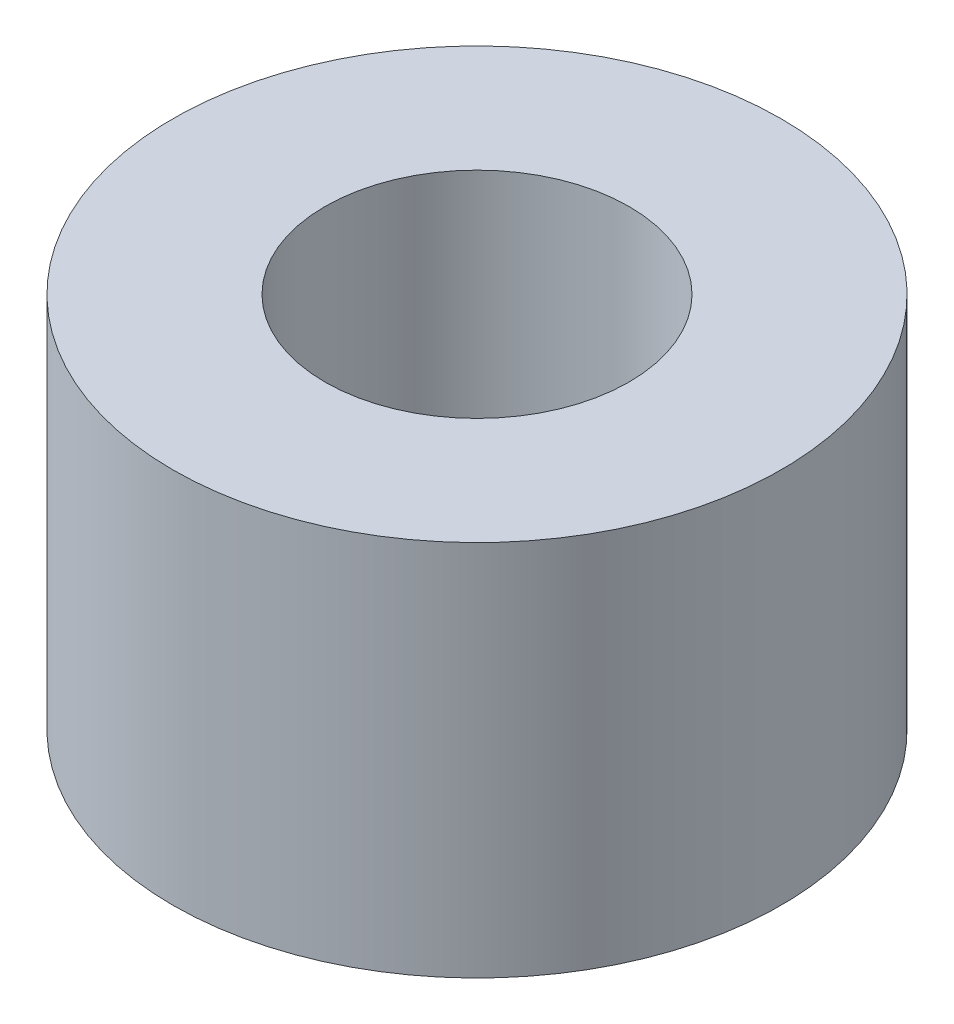
from build123d import *

# Parameters (mm, degrees)
SKETCH1_R           = 6.35
SKETCH1_R_2         = 3.175
BOSS_EXTRUDE1_DEPTH = 7.874


with BuildPart() as part:
    # Sketch1 → Boss-Extrude1 (new body)
    with BuildSketch(Plane(origin=(0, 0, 0), x_dir=(1, 0, 0), z_dir=(0, 1, 0))):
        Circle(SKETCH1_R)
        Circle(SKETCH1_R_2, mode=Mode.SUBTRACT)
    extrude(amount=BOSS_EXTRUDE1_DEPTH)


solid = part.part
